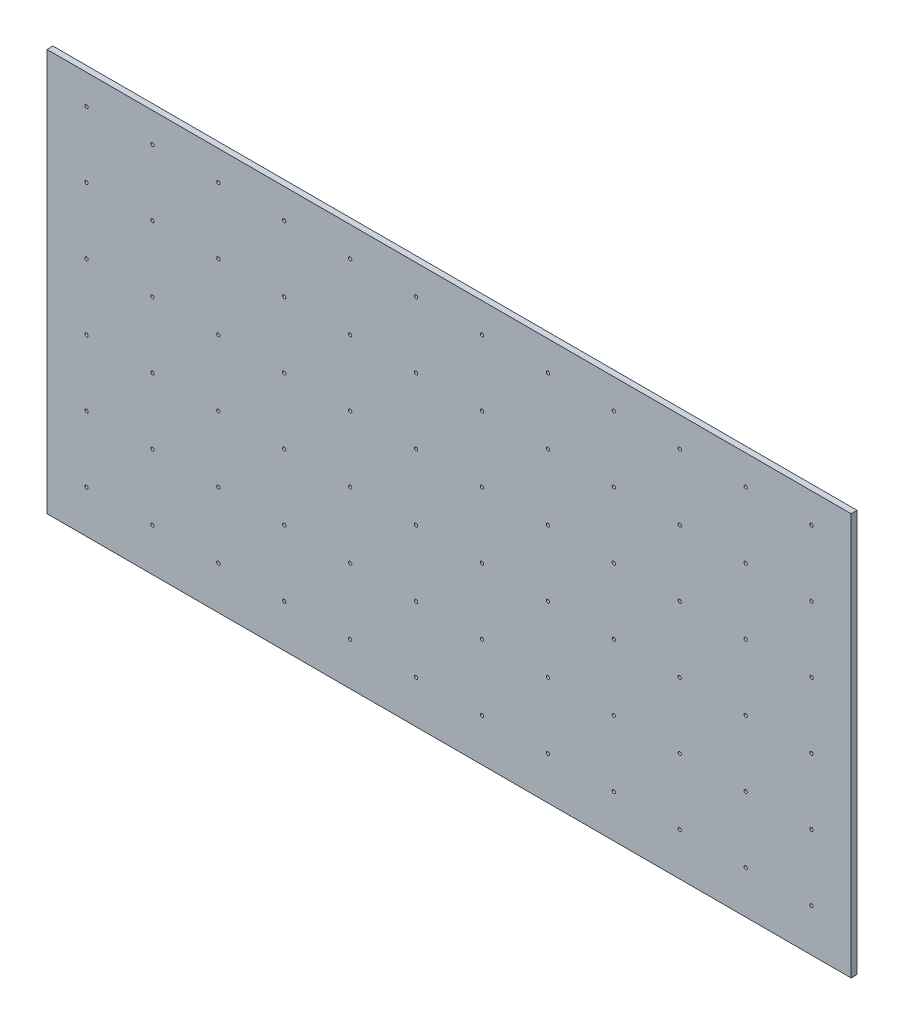
from build123d import *

# Parameters (mm, degrees)
SKETCH1_W           = 2440
SKETCH1_H           = 1220
SKETCH1_R           = 5
BOSS_EXTRUDE1_DEPTH = 18


with BuildPart() as part:
    # Sketch1 → Boss-Extrude1 (new body)
    with BuildSketch(Plane.XY):
        with Locations((-990.892018779, -8.591549296)):
            Rectangle(SKETCH1_W, SKETCH1_H)
        with Locations((-2090.892018779, 511.408450704)):
            Circle(SKETCH1_R, mode=Mode.SUBTRACT)
        with Locations((-1890.892018779, 511.408450704)):
            Circle(SKETCH1_R, mode=Mode.SUBTRACT)
        with Locations((-1690.892018779, 511.408450704)):
            Circle(SKETCH1_R, mode=Mode.SUBTRACT)
        with Locations((-1490.892018779, 511.408450704)):
            Circle(SKETCH1_R, mode=Mode.SUBTRACT)
        with Locations((-2090.892018779, 311.408450704)):
            Circle(SKETCH1_R, mode=Mode.SUBTRACT)
        with Locations((-1890.892018779, 311.408450704)):
            Circle(SKETCH1_R, mode=Mode.SUBTRACT)
        with Locations((-1690.892018779, 311.408450704)):
            Circle(SKETCH1_R, mode=Mode.SUBTRACT)
        with Locations((-1490.892018779, 311.408450704)):
            Circle(SKETCH1_R, mode=Mode.SUBTRACT)
        with Locations((-1290.892018779, 511.408450704)):
            Circle(SKETCH1_R, mode=Mode.SUBTRACT)
        with Locations((-1290.892018779, 311.408450704)):
            Circle(SKETCH1_R, mode=Mode.SUBTRACT)
        with Locations((-1090.892018779, 511.408450704)):
            Circle(SKETCH1_R, mode=Mode.SUBTRACT)
        with Locations((-1090.892018779, 311.408450704)):
            Circle(SKETCH1_R, mode=Mode.SUBTRACT)
        with Locations((-890.892018779, 511.408450704)):
            Circle(SKETCH1_R, mode=Mode.SUBTRACT)
        with Locations((-890.892018779, 311.408450704)):
            Circle(SKETCH1_R, mode=Mode.SUBTRACT)
        with Locations((-890.892018779, 111.408450704)):
            Circle(SKETCH1_R, mode=Mode.SUBTRACT)
        with Locations((-1090.892018779, 111.408450704)):
            Circle(SKETCH1_R, mode=Mode.SUBTRACT)
        with Locations((-1290.892018779, 111.408450704)):
            Circle(SKETCH1_R, mode=Mode.SUBTRACT)
        with Locations((-1490.892018779, 111.408450704)):
            Circle(SKETCH1_R, mode=Mode.SUBTRACT)
        with Locations((-1690.892018779, 111.408450704)):
            Circle(SKETCH1_R, mode=Mode.SUBTRACT)
        with Locations((-1890.892018779, 111.408450704)):
            Circle(SKETCH1_R, mode=Mode.SUBTRACT)
        with Locations((-2090.892018779, 111.408450704)):
            Circle(SKETCH1_R, mode=Mode.SUBTRACT)
        with Locations((-2090.892018779, -88.591549296)):
            Circle(SKETCH1_R, mode=Mode.SUBTRACT)
        with Locations((-1890.892018779, -88.591549296)):
            Circle(SKETCH1_R, mode=Mode.SUBTRACT)
        with Locations((-1690.892018779, -88.591549296)):
            Circle(SKETCH1_R, mode=Mode.SUBTRACT)
        with Locations((-1490.892018779, -88.591549296)):
            Circle(SKETCH1_R, mode=Mode.SUBTRACT)
        with Locations((-1290.892018779, -88.591549296)):
            Circle(SKETCH1_R, mode=Mode.SUBTRACT)
        with Locations((-1090.892018779, -88.591549296)):
            Circle(SKETCH1_R, mode=Mode.SUBTRACT)
        with Locations((-890.892018779, -88.591549296)):
            Circle(SKETCH1_R, mode=Mode.SUBTRACT)
        with Locations((-690.892018779, -88.591549296)):
            Circle(SKETCH1_R, mode=Mode.SUBTRACT)
        with Locations((-490.892018779, -88.591549296)):
            Circle(SKETCH1_R, mode=Mode.SUBTRACT)
        with Locations((-490.892018779, 111.408450704)):
            Circle(SKETCH1_R, mode=Mode.SUBTRACT)
        with Locations((-490.892018779, 311.408450704)):
            Circle(SKETCH1_R, mode=Mode.SUBTRACT)
        with Locations((-490.892018779, 511.408450704)):
            Circle(SKETCH1_R, mode=Mode.SUBTRACT)
        with Locations((-690.892018779, 511.408450704)):
            Circle(SKETCH1_R, mode=Mode.SUBTRACT)
        with Locations((-690.892018779, 311.408450704)):
            Circle(SKETCH1_R, mode=Mode.SUBTRACT)
        with Locations((-690.892018779, 111.408450704)):
            Circle(SKETCH1_R, mode=Mode.SUBTRACT)
        with Locations((-490.892018779, -288.591549296)):
            Circle(SKETCH1_R, mode=Mode.SUBTRACT)
        with Locations((-690.892018779, -288.591549296)):
            Circle(SKETCH1_R, mode=Mode.SUBTRACT)
        with Locations((-890.892018779, -288.591549296)):
            Circle(SKETCH1_R, mode=Mode.SUBTRACT)
        with Locations((-1090.892018779, -288.591549296)):
            Circle(SKETCH1_R, mode=Mode.SUBTRACT)
        with Locations((-1290.892018779, -288.591549296)):
            Circle(SKETCH1_R, mode=Mode.SUBTRACT)
        with Locations((-1490.892018779, -288.591549296)):
            Circle(SKETCH1_R, mode=Mode.SUBTRACT)
        with Locations((-1690.892018779, -288.591549296)):
            Circle(SKETCH1_R, mode=Mode.SUBTRACT)
        with Locations((-1890.892018779, -288.591549296)):
            Circle(SKETCH1_R, mode=Mode.SUBTRACT)
        with Locations((-2090.892018779, -288.591549296)):
            Circle(SKETCH1_R, mode=Mode.SUBTRACT)
        with Locations((-2090.892018779, -488.591549296)):
            Circle(SKETCH1_R, mode=Mode.SUBTRACT)
        with Locations((-1890.892018779, -488.591549296)):
            Circle(SKETCH1_R, mode=Mode.SUBTRACT)
        with Locations((-1690.892018779, -488.591549296)):
            Circle(SKETCH1_R, mode=Mode.SUBTRACT)
        with Locations((-1490.892018779, -488.591549296)):
            Circle(SKETCH1_R, mode=Mode.SUBTRACT)
        with Locations((-1290.892018779, -488.591549296)):
            Circle(SKETCH1_R, mode=Mode.SUBTRACT)
        with Locations((-1090.892018779, -488.591549296)):
            Circle(SKETCH1_R, mode=Mode.SUBTRACT)
        with Locations((-890.892018779, -488.591549296)):
            Circle(SKETCH1_R, mode=Mode.SUBTRACT)
        with Locations((-690.892018779, -488.591549296)):
            Circle(SKETCH1_R, mode=Mode.SUBTRACT)
        with Locations((-490.892018779, -488.591549296)):
            Circle(SKETCH1_R, mode=Mode.SUBTRACT)
        with Locations((-290.892018779, 511.408450704)):
            Circle(SKETCH1_R, mode=Mode.SUBTRACT)
        with Locations((-290.892018779, 311.408450704)):
            Circle(SKETCH1_R, mode=Mode.SUBTRACT)
        with Locations((-290.892018779, 111.408450704)):
            Circle(SKETCH1_R, mode=Mode.SUBTRACT)
        with Locations((-290.892018779, -88.591549296)):
            Circle(SKETCH1_R, mode=Mode.SUBTRACT)
        with Locations((-290.892018779, -288.591549296)):
            Circle(SKETCH1_R, mode=Mode.SUBTRACT)
        with Locations((-290.892018779, -488.591549296)):
            Circle(SKETCH1_R, mode=Mode.SUBTRACT)
        with Locations((-90.892018779, 511.408450704)):
            Circle(SKETCH1_R, mode=Mode.SUBTRACT)
        with Locations((-90.892018779, 311.408450704)):
            Circle(SKETCH1_R, mode=Mode.SUBTRACT)
        with Locations((-90.892018779, 111.408450704)):
            Circle(SKETCH1_R, mode=Mode.SUBTRACT)
        with Locations((-90.892018779, -88.591549296)):
            Circle(SKETCH1_R, mode=Mode.SUBTRACT)
        with Locations((-90.892018779, -288.591549296)):
            Circle(SKETCH1_R, mode=Mode.SUBTRACT)
        with Locations((-90.892018779, -488.591549296)):
            Circle(SKETCH1_R, mode=Mode.SUBTRACT)
        with Locations((109.107981221, -488.591549296)):
            Circle(SKETCH1_R, mode=Mode.SUBTRACT)
        with Locations((109.107981221, -288.591549296)):
            Circle(SKETCH1_R, mode=Mode.SUBTRACT)
        with Locations((109.107981221, -88.591549296)):
            Circle(SKETCH1_R, mode=Mode.SUBTRACT)
        with Locations((109.107981221, 111.408450704)):
            Circle(SKETCH1_R, mode=Mode.SUBTRACT)
        with Locations((109.107981221, 311.408450704)):
            Circle(SKETCH1_R, mode=Mode.SUBTRACT)
        with Locations((109.107981221, 511.408450704)):
            Circle(SKETCH1_R, mode=Mode.SUBTRACT)
    extrude(amount=BOSS_EXTRUDE1_DEPTH)


solid = part.part
